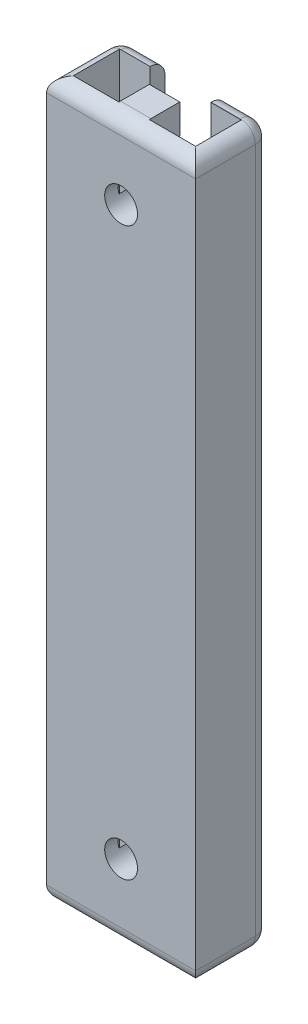
from build123d import *

# Parameters (mm, degrees)
SKETCH1_W           = 25
SKETCH1_H           = 25
BOSS_EXTRUDE1_DEPTH = 120
CUT_EXTRUDE1_DEPTH  = 120
SKETCH3_W           = 25
SKETCH3_H           = 12.5
CUT_EXTRUDE2_DEPTH  = 120
FILLET1_R           = 2.5
FILLET2_R           = 2.5
FILLET3_R           = 2.5
SKETCH6_R           = 2.75
CUT_EXTRUDE3_DEPTH  = 10
SKETCH7_W           = 10.05
SKETCH7_H           = 15.1
CUT_EXTRUDE4_DEPTH  = 2.5


with BuildPart() as part:
    # Sketch1 → Boss-Extrude1 (new body)
    with BuildSketch(Plane(origin=(0, 0, 0), x_dir=(1, 0, 0), z_dir=(0, 1, 0))):
        Rectangle(SKETCH1_W, SKETCH1_H)
    extrude(amount=BOSS_EXTRUDE1_DEPTH)

    # Sketch2 → Cut-Extrude1 (cut)
    with BuildSketch(Plane(origin=(0, 120, 0), x_dir=(1, 0, 0), z_dir=(0, 1, 0))):
        Polygon((-10.25, -2.48824277), (-10.25, -10.25), (-2.61175723, -10.25), (-2.61175723, -5.15), (2.48824277, -5.15), (2.48824277, -10.25), (10.25, -10.25), (10.25, -2.61175723), (5.15, -2.61175723), (5.15, 2.48824277), (10.25, 2.48824277), (10.25, 10.25), (2.61175723, 10.25), (2.61175723, 5.15), (-2.48824277, 5.15), (-2.48824277, 10.25), (-10.25, 10.25), (-10.25, 2.61175723), (-5.15, 2.61175723), (-5.15, -2.48824277), align=None)
    extrude(amount=-CUT_EXTRUDE1_DEPTH, mode=Mode.SUBTRACT)

    # Sketch3 → Cut-Extrude2 (cut)
    with BuildSketch(Plane(origin=(0, 120, 0), x_dir=(1, 0, 0), z_dir=(0, 1, 0))):
        with Locations((0, 6.25)):
            Rectangle(SKETCH3_W, SKETCH3_H)
    extrude(amount=-CUT_EXTRUDE2_DEPTH, mode=Mode.SUBTRACT)

    # Fillet1
    fillet1_edges = [part.edges().sort_by_distance(p)[0] for p in [
        (-12.5, 60, 0),
    ]]
    fillet(fillet1_edges, radius=FILLET1_R)

    # Fillet2
    fillet2_edges = [part.edges().sort_by_distance(p)[0] for p in [
        (12.5, 60, 0),
    ]]
    fillet(fillet2_edges, radius=FILLET2_R)

    # Fillet3
    # the kernel refuses this fillet: 2.5 mm, written as the material it takes off along each edge
    with BuildSketch(Plane(origin=(-10, 0, 0), x_dir=(0, 0, 1), z_dir=(1, 0, 0)), Plane(origin=(-1.1, 0, 0), x_dir=(0, 0, 1), z_dir=(1, 0, 0)), Plane(origin=(-10, 120, 0), x_dir=(0, -1, 0), z_dir=(1, 0, 0)), Plane(origin=(-1.1, 120, 0), x_dir=(0, -1, 0), z_dir=(1, 0, 0))) as fillet3_piece_1:
        with BuildLine():
            CenterArc((FILLET3_R, -FILLET3_R), FILLET3_R, 90, 90)
            Line((0, -FILLET3_R), (0, 0))
            Line((0, 0), (FILLET3_R, 0))
        make_face()
    extrude(amount=11.1, mode=Mode.SUBTRACT)
    with BuildSketch(Plane(origin=(-10, 0, 2.5), x_dir=(-1, 0, 0), z_dir=(0, 0, 1))) as fillet3_piece_2:
        with BuildLine():
            CenterArc((2.5 - FILLET3_R, -FILLET3_R), FILLET3_R, 0, 90)
            Line((2.5, -FILLET3_R), (2.5, 0))
            Line((2.5, 0), (2.5 - FILLET3_R, 0))
        make_face()
    revolve(axis=Axis((-10, 0, 2.5), (0, -1, 0)), revolution_arc=90, mode=Mode.SUBTRACT)
    with BuildSketch(Plane(origin=(10, 0, 2.5), x_dir=(1, 0, 0), z_dir=(0, 0, 1))) as fillet3_piece_3:
        with BuildLine():
            CenterArc((2.5 - FILLET3_R, FILLET3_R), FILLET3_R, 270, 90)
            Line((2.5, FILLET3_R), (2.5, 0))
            Line((2.5, 0), (2.5 - FILLET3_R, 0))
        make_face()
    revolve(axis=Axis((10, 0, 2.5), (0, 1, 0)), revolution_arc=90, mode=Mode.SUBTRACT)
    with BuildSketch(Plane(origin=(-10, 120, 2.5), x_dir=(-1, 0, 0), z_dir=(0, 0, 1))) as fillet3_piece_4:
        with BuildLine():
            CenterArc((2.5 - FILLET3_R, FILLET3_R), FILLET3_R, 270, 90)
            Line((2.5 - FILLET3_R, 0), (2.5, 0))
            Line((2.5, 0), (2.5, FILLET3_R))
        make_face()
    revolve(axis=Axis((-10, 120, 2.5), (0, -1, 0)), revolution_arc=90, mode=Mode.SUBTRACT)
    with BuildSketch(Plane(origin=(10, 120, 2.5), x_dir=(1, 0, 0), z_dir=(0, 0, 1))) as fillet3_piece_5:
        with BuildLine():
            CenterArc((2.5 - FILLET3_R, -FILLET3_R), FILLET3_R, 0, 90)
            Line((2.5 - FILLET3_R, 0), (2.5, 0))
            Line((2.5, 0), (2.5, -FILLET3_R))
        make_face()
    revolve(axis=Axis((10, 120, 2.5), (0, 1, 0)), revolution_arc=90, mode=Mode.SUBTRACT)
    with BuildSketch(Plane(origin=(-18.75, 0, 12.5), x_dir=(0, 0, -1), z_dir=(1, 0, 0)), Plane(origin=(-18.75, 120, 12.5), x_dir=(0, -1, 0), z_dir=(1, 0, 0))) as fillet3_piece_6:
        with BuildLine():
            CenterArc((FILLET3_R, FILLET3_R), FILLET3_R, 180, 90)
            Line((0, FILLET3_R), (0, 0))
            Line((0, 0), (FILLET3_R, 0))
        make_face()
    extrude(amount=37.5, mode=Mode.SUBTRACT)
    with BuildSketch(Plane(origin=(-12.5, 0, 2.5), x_dir=(1, 0, 0), z_dir=(0, 0, 1)), Plane(origin=(12.5, 0, 18.75), x_dir=(-1, 0, 0), z_dir=(0, 0, -1)), Plane(origin=(-12.5, 120, 2.5), x_dir=(0, -1, 0), z_dir=(0, 0, 1)), Plane(origin=(12.5, 120, 18.75), x_dir=(0, -1, 0), z_dir=(0, 0, -1))) as fillet3_piece_7:
        with BuildLine():
            CenterArc((FILLET3_R, FILLET3_R), FILLET3_R, 180, 90)
            Line((0, FILLET3_R), (0, 0))
            Line((0, 0), (FILLET3_R, 0))
        make_face()
    extrude(amount=16.25, mode=Mode.SUBTRACT)

    # Sketch6 → Cut-Extrude3 (cut)
    with BuildSketch(Plane.XY.offset(12.5)):
        with Locations((0, 107.5)):
            Circle(SKETCH6_R)
        with Locations((0, 12.5)):
            Circle(SKETCH6_R)
    extrude(amount=-CUT_EXTRUDE3_DEPTH, mode=Mode.SUBTRACT)

    # Sketch7 → Cut-Extrude4 (cut)
    with BuildSketch(Plane(origin=(0, 0, 5.15), x_dir=(-1, 0, 0), z_dir=(0, 0, -1))):
        with Locations((0, 107.5)):
            Rectangle(SKETCH7_W, SKETCH7_H)
        with Locations((0, 12.5)):
            Rectangle(SKETCH7_W, SKETCH7_H)
    extrude(amount=-CUT_EXTRUDE4_DEPTH, mode=Mode.SUBTRACT)


solid = part.part
